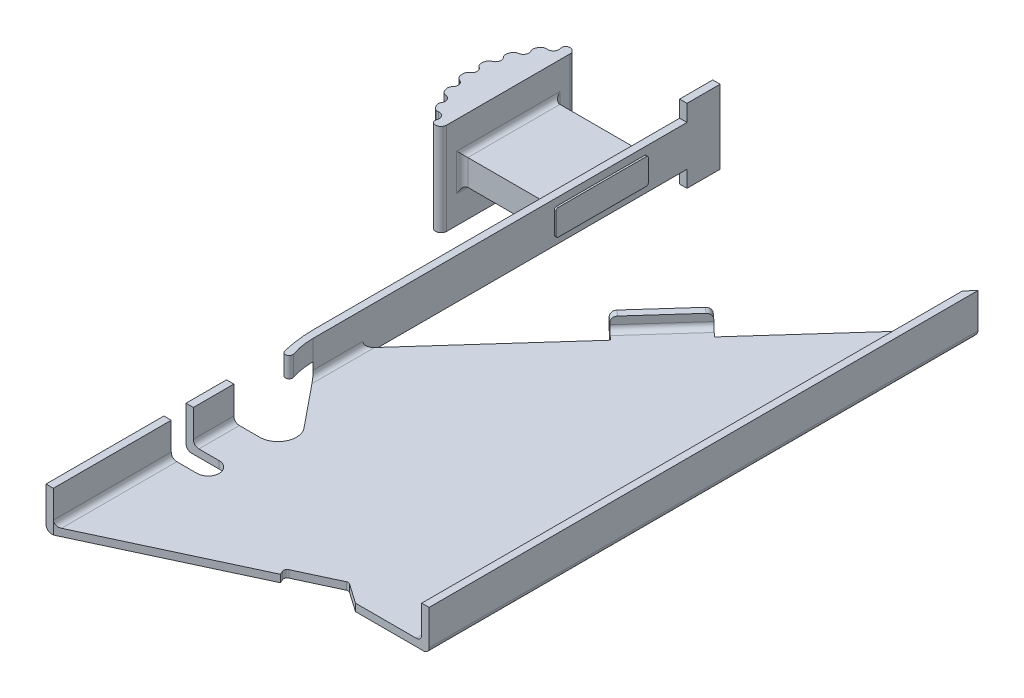
from build123d import *

# Parameters (mm, degrees)
SKETCH1_W                = 20.574
SKETCH1_H                = 44.196
BOSS_EXTRUDE1_DEPTH      = 1.397
SHELL1_T                 = -0.508
CUT_EXTRUDE1_DEPTH       = 25.415068749
CUT_EXTRUDE1_DEPTH_BACK  = 25.415068749
CUT_EXTRUDE2_DEPTH       = 25.415068749
CUT_EXTRUDE2_DEPTH_BACK  = 25.415068749
SKETCH5_W                = 2.286
SKETCH5_H                = 5.08
BOSS_EXTRUDE2_DEPTH      = 0.508
BOSS_EXTRUDE3_DEPTH      = 5.842
BOSS_EXTRUDE3_DEPTH_BACK = 0.635
SKETCH6_W                = 6.35
SKETCH6_H                = 1.778
BOSS_EXTRUDE4_DEPTH      = 3.175
SKETCH8_R                = 0.381
CUT_EXTRUDE3_DEPTH       = 31.873801871
FILLET1_R                = 0.381
CIRPATTERN1_START        = -3.175
CIRPATTERN1_DEPTH        = 6.35
CUT_EXTRUDE4_DEPTH       = 31.853319649
CUT_EXTRUDE4_DEPTH_BACK  = 31.853319649
BOSS_EXTRUDE5_DEPTH      = 1.397
BOSS_EXTRUDE6_REACH      = 32.853
SHELL2_START             = -7.869211645
SHELL2_OUTLINE_W         = 5.08
SHELL2_OUTLINE_H         = 0.889
SHELL2_DEPTH             = 0.762
FILLET2_R                = 0.381
FILLET6_R                = 0.127


# Read off the part's stored shape, not the designer's step: CirPattern1, Shell2
with BuildPart() as part:
    # Sketch1 → Boss-Extrude1 (new, symmetric)
    with BuildSketch(Plane(origin=(0, 0, 0), x_dir=(1, 0, 0), z_dir=(0, 1, 0))):
        Rectangle(SKETCH1_W, SKETCH1_H)
    extrude(amount=BOSS_EXTRUDE1_DEPTH, both=True)

    # Shell1
    shell1_openings = [part.faces().sort_by_distance(p)[0] for p in [
        (0, 1.397, 0),
    ]]
    offset(amount=SHELL1_T, openings=shell1_openings, kind=Kind.INTERSECTION)

    # Sketch3 → Cut-Extrude1 (cut, two sides: drawn at the far end of the back side and taken through both)
    with BuildSketch(Plane(origin=(0, 0, 0), x_dir=(1, 0, 0), z_dir=(0, 1, 0)).offset(-CUT_EXTRUDE1_DEPTH_BACK)):
        Polygon((10.287, 22.098), (-9.779, -0.254), (-9.779, 22.098), align=None)
    extrude(amount=CUT_EXTRUDE1_DEPTH + CUT_EXTRUDE1_DEPTH_BACK, mode=Mode.SUBTRACT)

    # Sketch4 → Cut-Extrude2 (cut, two sides: drawn at the far end of the back side and taken through both)
    with BuildSketch(Plane(origin=(0, 0, 0), x_dir=(1, 0, 0), z_dir=(0, 1, 0)).offset(-CUT_EXTRUDE2_DEPTH_BACK)):
        with BuildLine():
            Line((-10.287, -22.098), (10.287, -22.098))
            Line((10.287, -22.098), (10.287, -15.748))
            Line((10.287, -15.748), (5.207, -15.748))
            Line((5.207, -15.748), (3.864134037, -14.80771513))
            ThreePointArc((3.864134037, -14.80771513), (3.740583181, -14.762746296), (3.611100584, -14.785577571))
            Line((3.611100584, -14.785577571), (0.917342395, -16.041697644))
            ThreePointArc((0.917342395, -16.041697644), (0.786005508, -16.185026705), (0.794485256, -16.37924486))
            Line((0.794485256, -16.37924486), (0.901830294, -16.609447038))
            Line((0.901830294, -16.609447038), (-9.779, -21.59))
            Line((-9.779, -21.59), (-10.287, -21.59))
            Line((-10.287, -21.59), (-10.287, -22.098))
        make_face()
    extrude(amount=CUT_EXTRUDE2_DEPTH + CUT_EXTRUDE2_DEPTH_BACK, mode=Mode.SUBTRACT)

    # Sketch5 → Boss-Extrude2 (add)
    with BuildSketch(Plane.ZY.offset(10.287)):
        with Locations((-23.241, 0)):
            Rectangle(SKETCH5_W, SKETCH5_H)
    extrude(amount=-BOSS_EXTRUDE2_DEPTH)

    # Sketch6 → Boss-Extrude3 (add, two sides: drawn at the far end of the back side and taken through both)
    with BuildSketch(Plane.ZY.offset(10.287).offset(-BOSS_EXTRUDE3_DEPTH_BACK)):
        with Locations((-16.129, 0)):
            Rectangle(SKETCH6_W, SKETCH6_H)
    extrude(amount=BOSS_EXTRUDE3_DEPTH + BOSS_EXTRUDE3_DEPTH_BACK)

    # Sketch7 → Boss-Extrude4 (add, symmetric)
    with BuildSketch(Plane(origin=(0, 0, 0), x_dir=(1, 0, 0), z_dir=(0, 1, 0))):
        with BuildLine():
            Line((-16.129, 11.049), (-16.129, 21.209))
            ThreePointArc((-16.129, 21.209), (-18.669, 16.129), (-16.129, 11.049))
        make_face()
    extrude(amount=BOSS_EXTRUDE4_DEPTH, both=True)

    # Sketch8 → Cut-Extrude3 (cut, symmetric)
    with BuildSketch(Plane(origin=(0, 0, 0), x_dir=(1, 0, 0), z_dir=(0, 1, 0))):
        with Locations((-17.145, 20.25601151)):
            Circle(SKETCH8_R)
    extrude(amount=CUT_EXTRUDE3_DEPTH, both=True, mode=Mode.SUBTRACT)

    # Fillet1
    # the kernel refuses this fillet: 0.381 mm, written as the material it takes off along each edge
    with BuildSketch(Plane(origin=(-16.129, -5.314598451, -21.209), x_dir=(0, 0, 1), z_dir=(0, 1, 0))) as fillet1_piece_1:
        with BuildLine():
            CenterArc((0.829767065, -0.381), FILLET1_R, 90, 134.597956661)
            ThreePointArc((0.558475601, -0.648510638), (0.268299759, -0.333674793), (0, 0))
            Line((0, 0), (0.829767065, 0))
        make_face()
    extrude(amount=10.629196903, mode=Mode.SUBTRACT)
    with BuildSketch(Plane(origin=(-16.888803964, -3.924719523, -20.538012558), x_dir=(0.5312847358041962, 0, 0.8471933247502991), z_dir=(0, 1, 0))) as fillet1_piece_2:
        with BuildLine():
            CenterArc((0.308389086, 0.366870424), FILLET1_R, 191.227508383, 63.119725462)
            ThreePointArc((-0.065319255, 0.292687706), (-0.034387693, 0.1459582), (0, 0))
            ThreePointArc((0, 0), (0.102796362, 0.014129576), (0.205592724, 0))
        make_face()
    extrude(amount=7.849439047, mode=Mode.SUBTRACT)
    with BuildSketch(Plane(origin=(-17.383822436, -3.924719523, -19.95915322), x_dir=(0.919383333537804, 0, 0.39336279185112943), z_dir=(0, 1, 0))) as fillet1_piece_3:
        with BuildLine():
            CenterArc((0.308389086, -0.366870424), FILLET1_R, 105.652766155, 63.119725462)
            ThreePointArc((-0.065319255, -0.292687706), (-0.034387693, -0.1459582), (0, 0))
            ThreePointArc((0, 0), (0.102796362, -0.014129576), (0.205592724, 0))
        make_face()
    extrude(amount=7.849439047, mode=Mode.SUBTRACT)

    # CirPattern1 outline → CirPattern1 (cut)
    with BuildSketch(Plane(origin=(0, 0, 0), x_dir=(1, 0, 0), z_dir=(0, 1, 0)).offset(CIRPATTERN1_START)):
        with BuildLine():
            ThreePointArc((-16.777510638, 11.607475601), (-16.809726428, 11.745008607), (-16.789621511, 11.884826264))
            ThreePointArc((-16.789621511, 11.884826264), (-16.855265692, 12.249273725), (-17.19948569, 12.38581567))
            ThreePointArc((-17.19948569, 12.38581567), (-17.404514793, 12.415873831), (-17.563486704, 12.548796206))
            ThreePointArc((-17.563486704, 12.548796206), (-17.193275379, 12.059117997), (-16.777510638, 11.607475601))
        make_face()
        with BuildLine():
            ThreePointArc((-16.129, 11.878767065), (-16.36296353, 11.527282675), (-16.777510638, 11.607475601))
            ThreePointArc((-16.777510638, 11.607475601), (-16.462674793, 11.317299759), (-16.129, 11.049))
            Line((-16.129, 11.049), (-16.129, 11.878767065))
        make_face()
        with BuildLine():
            ThreePointArc((-17.633655181, 19.604189248), (-17.975088939, 19.015374527), (-18.251537846, 18.393397205))
            ThreePointArc((-18.251537846, 18.393397205), (-18.127780644, 18.559603646), (-17.935337257, 18.63645395))
            ThreePointArc((-17.935337257, 18.63645395), (-17.635723603, 18.842192055), (-17.644932405, 19.20552621))
            ThreePointArc((-17.644932405, 19.20552621), (-17.695623525, 19.406451162), (-17.633655181, 19.604189248))
        make_face()
        with BuildLine():
            ThreePointArc((-18.298077653, 18.26748788), (-18.492621503, 17.615236028), (-18.616234382, 16.945908274))
            ThreePointArc((-18.616234382, 16.945908274), (-18.534696725, 17.136412963), (-18.365510912, 17.256064903))
            ThreePointArc((-18.365510912, 17.256064903), (-18.122204213, 17.526061867), (-18.215977249, 17.877207318))
            ThreePointArc((-18.215977249, 17.877207318), (-18.312172768, 18.060747091), (-18.298077653, 18.26748788))
        make_face()
        with BuildLine():
            ThreePointArc((-18.632095343, 16.812613331), (-18.66899876, 16.132967891), (-18.632944744, 15.453276862))
            ThreePointArc((-18.632944744, 15.453276862), (-18.598132415, 15.657552479), (-18.46155341, 15.81339407))
            ThreePointArc((-18.46155341, 15.81339407), (-18.287998835, 16.132729817), (-18.461154191, 16.452282211))
            ThreePointArc((-18.461154191, 16.452282211), (-18.59753833, 16.608294367), (-18.632095343, 16.812613331))
        make_face()
        with BuildLine():
            ThreePointArc((-18.617250379, 15.319962201), (-18.494474074, 14.650480486), (-18.300745514, 13.997986017))
            ThreePointArc((-18.300745514, 13.997986017), (-18.314582249, 14.20474426), (-18.218157429, 14.388163671))
            ThreePointArc((-18.218157429, 14.388163671), (-18.12394563, 14.739191657), (-18.366914716, 15.009492478))
            ThreePointArc((-18.366914716, 15.009492478), (-18.535950864, 15.129355761), (-18.617250379, 15.319962201))
        make_face()
        with BuildLine():
            ThreePointArc((-18.254363096, 13.872018629), (-17.978691709, 13.249696306), (-17.637994075, 12.660455345))
            ThreePointArc((-17.637994075, 12.660455345), (-17.699715253, 12.85827072), (-17.64877307, 13.059132165))
            ThreePointArc((-17.64877307, 13.059132165), (-17.639110206, 13.422454528), (-17.93846651, 13.628566908))
            ThreePointArc((-17.93846651, 13.628566908), (-18.130813704, 13.705657654), (-18.254363096, 13.872018629))
        make_face()
    extrude(amount=CIRPATTERN1_DEPTH, mode=Mode.SUBTRACT)

    # Sketch9 → Cut-Extrude4 (cut, two sides: drawn at the far end of the back side and taken through both)
    with BuildSketch(Plane(origin=(0, 0, 0), x_dir=(1, 0, 0), z_dir=(0, 1, 0)).offset(-CUT_EXTRUDE4_DEPTH_BACK)):
        with BuildLine():
            Line((-8.001, -11.938), (-10.287, -11.938))
            Line((-10.287, -11.938), (-10.287, -13.462))
            Line((-10.287, -13.462), (-8.001, -13.462))
            ThreePointArc((-8.001, -13.462), (-7.239, -12.7), (-8.001, -11.938))
        make_face()
        with BuildLine():
            Line((-8.001, -9.144), (-10.287, -9.144))
            Line((-10.287, -9.144), (-10.287, -3.048))
            Line((-10.287, -3.048), (-7.015482933, -7.0729656))
            ThreePointArc((-7.015482933, -7.0729656), (-6.854218921, -8.419704275), (-8.001, -9.144))
        make_face()
    extrude(amount=CUT_EXTRUDE4_DEPTH + CUT_EXTRUDE4_DEPTH_BACK, mode=Mode.SUBTRACT)

    # Sketch10 → Boss-Extrude5 (add)
    with BuildSketch(Plane(origin=(0, 0, 0), x_dir=(1, 0, 0), z_dir=(0, 1, 0))):
        with BuildLine():
            Line((-10.287, -3.048), (-9.779, -3.672995219))
            ThreePointArc((-9.779, -3.672995219), (-9.713577615, -4.485652185), (-9.518995533, -5.277377672))
            ThreePointArc((-9.518995533, -5.277377672), (-9.690211017, -5.601822413), (-10.00699519, -5.416817226))
            ThreePointArc((-10.00699519, -5.416817226), (-10.216755971, -4.240654366), (-10.287, -3.048))
        make_face()
    extrude(amount=BOSS_EXTRUDE5_DEPTH)

    # Boss-Extrude6: up to this face of the body (flat: up to its plane)
    boss_extrude6_end = Plane(part.part.faces().sort_by_distance((1.063267264, -1.397, 2.310847226))[0])
    # Sketch11 → Boss-Extrude6 (add, up to the picked face)
    with BuildSketch(Plane(origin=(0, 0, 0), x_dir=(1, 0, 0), z_dir=(0, 1, 0)), mode=Mode.PRIVATE) as boss_extrude6_sk1:
        Polygon((-1.696795769, 8.748961675), (-2.641846577, 9.59735956), (0.751744961, 13.377562792), (1.696795769, 12.529164907), align=None)
    boss_extrude6_tool1 = split(extrude(boss_extrude6_sk1.sketch, amount=-BOSS_EXTRUDE6_REACH, mode=Mode.PRIVATE), bisect_by=boss_extrude6_end, keep=Keep.BOTH, mode=Mode.PRIVATE)
    add(boss_extrude6_tool1.solids().sort_by(Axis((-0.472525, 0, -11.063262), (0, -1, 0)))[0])

    # Shell2 outline → Shell2 (cut)
    with BuildSketch(Plane(origin=(0, 0, 0), x_dir=(0.668029830269147, 0, -0.7441344944770231), z_dir=(0.7441344944770231, 0, 0.6680298302691471)).offset(SHELL2_START)):
        with Locations((7.916893984, -0.4445)):
            Rectangle(SHELL2_OUTLINE_W, SHELL2_OUTLINE_H)
    extrude(amount=SHELL2_DEPTH, mode=Mode.SUBTRACT)

    # Fillet2
    fillet2_edges = [part.edges().sort_by_distance(p)[0] for p in [
        (-16.129, 0, -19.304),
        (-16.129, -0.889, -16.129),
        (-16.129, 0, -12.954),
        (-16.129, 0.889, -16.129),
        (-9.779, -0.889, 1.963497609),
        (-9.779, -0.889, 10.541),
        (-9.779, -0.889, 17.526),
        (-10.287, -1.397, 10.541),
        (-10.287, -1.397, 17.526),
        (0.940755122, 0, -13.207883215),
        (-2.452836415, 0, -9.427679983),
        (-0.945050808, -1.397, -11.487461176),
        (-0.567030485, -0.889, -11.148102022),
        (9.779, -0.889, -2.892063291),
        (10.287, -1.397, -3.175),
        (-10.287, -1.397, -9.525),
    ]]
    fillet(fillet2_edges, radius=FILLET2_R)

    # Fillet6
    fillet6_edges = [part.edges().sort_by_distance(p)[0] for p in [
        (-9.7155, -0.889, -19.304),
        (-9.7155, 0.889, -19.304),
        (-9.7155, 0.889, -12.954),
        (-9.7155, -0.889, -12.954),
    ]]
    fillet(fillet6_edges, radius=FILLET6_R)


solid = part.part
